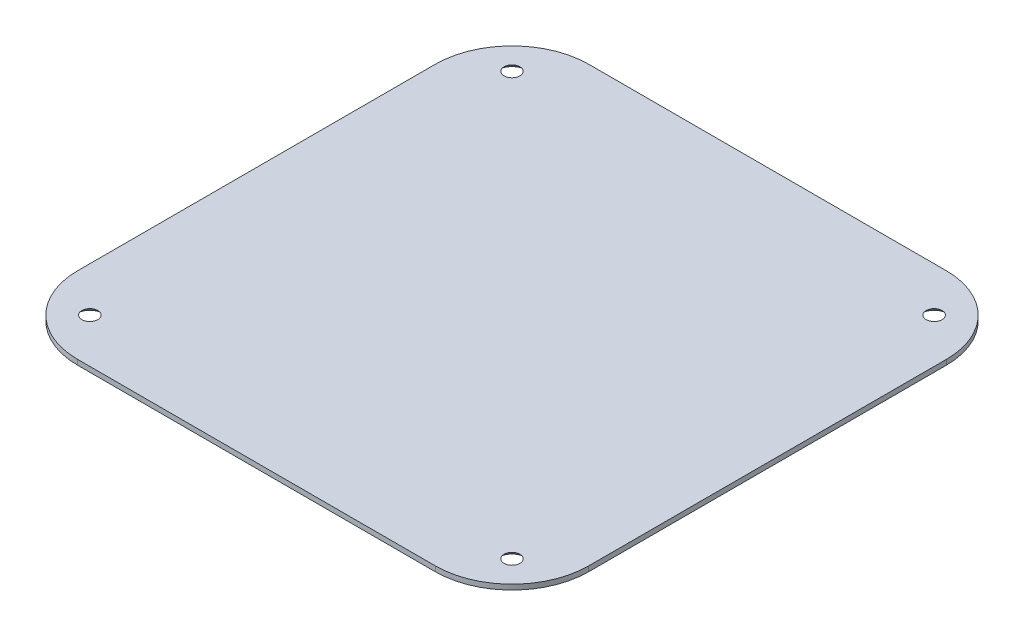
from build123d import *

# Parameters (mm, degrees)
SKETCH1_R           = 2.6
BOSS_EXTRUDE1_DEPTH = 2
CUT_EXTRUDE1_DEPTH  = 0.1
CHAMFER1_SIZE       = 2.5


with BuildPart() as part:
    # Sketch1 → Boss-Extrude1 (new body)
    with BuildSketch(Plane(origin=(0, 0, 0), x_dir=(1, 0, 0), z_dir=(0, 1, 0))):
        with BuildLine():
            Line((70, -100), (-70, -100))
            ThreePointArc((-70, -100), (-91.213203436, -91.213203436), (-100, -70))
            Line((-100, -70), (-100, 70))
            ThreePointArc((-100, 70), (-91.213203436, 91.213203436), (-70, 100))
            Line((-70, 100), (70, 100))
            ThreePointArc((70, 100), (91.213203436, 91.213203436), (100, 70))
            Line((100, 70), (100, -70))
            ThreePointArc((100, -70), (91.213203436, -91.213203436), (70, -100))
        make_face()
        with Locations(Location((-82.6, 82.6, 0), (0, 0, 270))):
            Circle(SKETCH1_R, mode=Mode.SUBTRACT)
        with Locations(Location((82.6, 82.6, 0), (0, 0, 270))):
            Circle(SKETCH1_R, mode=Mode.SUBTRACT)
        with Locations(Location((82.6, -82.6, 0), (0, 0, 270))):
            Circle(SKETCH1_R, mode=Mode.SUBTRACT)
        with Locations(Location((-82.6, -82.6, 0), (0, 0, 270))):
            Circle(SKETCH1_R, mode=Mode.SUBTRACT)
    extrude(amount=BOSS_EXTRUDE1_DEPTH)

    # Sketch1<3> → Cut-Extrude1 (cut)
    with BuildSketch(Plane(origin=(0, 0, 0), x_dir=(1, 0, 0), z_dir=(0, 1, 0))):
        with BuildLine():
            Line((-42.5, 50), (-42.5, 70))
            ThreePointArc((-42.5, 70), (-44.696699141, 75.303300859), (-50, 77.5))
            Line((-50, 77.5), (-70, 77.5))
            ThreePointArc((-70, 77.5), (-75.303300859, 75.303300859), (-77.5, 70))
            Line((-77.5, 70), (-77.5, 50))
            ThreePointArc((-77.5, 50), (-75.303300859, 44.696699141), (-70, 42.5))
            Line((-70, 42.5), (-50, 42.5))
            ThreePointArc((-50, 42.5), (-44.696699141, 44.696699141), (-42.5, 50))
        make_face()
        with BuildLine():
            Line((-70, 2.5), (-50, 2.5))
            ThreePointArc((-50, 2.5), (-44.696699141, 4.696699141), (-42.5, 10))
            Line((-42.5, 10), (-42.5, 30))
            ThreePointArc((-42.5, 30), (-44.696699141, 35.303300859), (-50, 37.5))
            Line((-50, 37.5), (-70, 37.5))
            ThreePointArc((-70, 37.5), (-75.303300859, 35.303300859), (-77.5, 30))
            Line((-77.5, 30), (-77.5, 10))
            ThreePointArc((-77.5, 10), (-75.303300859, 4.696699141), (-70, 2.5))
        make_face()
        with BuildLine():
            Line((-10, 77.5), (-30, 77.5))
            ThreePointArc((-30, 77.5), (-35.303300859, 75.303300859), (-37.5, 70))
            Line((-37.5, 70), (-37.5, 50))
            ThreePointArc((-37.5, 50), (-35.303300859, 44.696699141), (-30, 42.5))
            Line((-30, 42.5), (-10, 42.5))
            ThreePointArc((-10, 42.5), (-4.696699141, 44.696699141), (-2.5, 50))
            Line((-2.5, 50), (-2.5, 70))
            ThreePointArc((-2.5, 70), (-4.696699141, 75.303300859), (-10, 77.5))
        make_face()
        with BuildLine():
            Line((-10, 37.5), (-30, 37.5))
            ThreePointArc((-30, 37.5), (-35.303300859, 35.303300859), (-37.5, 30))
            Line((-37.5, 30), (-37.5, 10))
            ThreePointArc((-37.5, 10), (-35.303300859, 4.696699141), (-30, 2.5))
            Line((-30, 2.5), (-10, 2.5))
            ThreePointArc((-10, 2.5), (-4.696699141, 4.696699141), (-2.5, 10))
            Line((-2.5, 10), (-2.5, 30))
            ThreePointArc((-2.5, 30), (-4.696699141, 35.303300859), (-10, 37.5))
        make_face()
        with BuildLine():
            Line((42.5, 30), (42.5, 10))
            ThreePointArc((42.5, 10), (44.696699141, 4.696699141), (50, 2.5))
            Line((50, 2.5), (70, 2.5))
            ThreePointArc((70, 2.5), (75.303300859, 4.696699141), (77.5, 10))
            Line((77.5, 10), (77.5, 30))
            ThreePointArc((77.5, 30), (75.303300859, 35.303300859), (70, 37.5))
            Line((70, 37.5), (50, 37.5))
            ThreePointArc((50, 37.5), (44.696699141, 35.303300859), (42.5, 30))
        make_face()
        with BuildLine():
            ThreePointArc((50, 77.5), (44.696699141, 75.303300859), (42.5, 70))
            Line((42.5, 70), (42.5, 50))
            ThreePointArc((42.5, 50), (44.696699141, 44.696699141), (50, 42.5))
            Line((50, 42.5), (70, 42.5))
            ThreePointArc((70, 42.5), (75.303300859, 44.696699141), (77.5, 50))
            Line((77.5, 50), (77.5, 70))
            ThreePointArc((77.5, 70), (75.303300859, 75.303300859), (70, 77.5))
            Line((70, 77.5), (50, 77.5))
        make_face()
        with BuildLine():
            ThreePointArc((10, 77.5), (4.696699141, 75.303300859), (2.5, 70))
            Line((2.5, 70), (2.5, 50))
            ThreePointArc((2.5, 50), (4.696699141, 44.696699141), (10, 42.5))
            Line((10, 42.5), (30, 42.5))
            ThreePointArc((30, 42.5), (35.303300859, 44.696699141), (37.5, 50))
            Line((37.5, 50), (37.5, 70))
            ThreePointArc((37.5, 70), (35.303300859, 75.303300859), (30, 77.5))
            Line((30, 77.5), (10, 77.5))
        make_face()
        with BuildLine():
            ThreePointArc((30, 2.5), (35.303300859, 4.696699141), (37.5, 10))
            Line((37.5, 10), (37.5, 30))
            ThreePointArc((37.5, 30), (35.303300859, 35.303300859), (30, 37.5))
            Line((30, 37.5), (10, 37.5))
            ThreePointArc((10, 37.5), (4.696699141, 35.303300859), (2.5, 30))
            Line((2.5, 30), (2.5, 10))
            ThreePointArc((2.5, 10), (4.696699141, 4.696699141), (10, 2.5))
            Line((10, 2.5), (30, 2.5))
        make_face()
        with BuildLine():
            ThreePointArc((-50, -77.5), (-44.696699141, -75.303300859), (-42.5, -70))
            Line((-42.5, -70), (-42.5, -50))
            ThreePointArc((-42.5, -50), (-44.696699141, -44.696699141), (-50, -42.5))
            Line((-50, -42.5), (-70, -42.5))
            ThreePointArc((-70, -42.5), (-75.303300859, -44.696699141), (-77.5, -50))
            Line((-77.5, -50), (-77.5, -70))
            ThreePointArc((-77.5, -70), (-75.303300859, -75.303300859), (-70, -77.5))
            Line((-70, -77.5), (-50, -77.5))
        make_face()
        with BuildLine():
            ThreePointArc((-10, -77.5), (-4.696699141, -75.303300859), (-2.5, -70))
            Line((-2.5, -70), (-2.5, -50))
            ThreePointArc((-2.5, -50), (-4.696699141, -44.696699141), (-10, -42.5))
            Line((-10, -42.5), (-30, -42.5))
            ThreePointArc((-30, -42.5), (-35.303300859, -44.696699141), (-37.5, -50))
            Line((-37.5, -50), (-37.5, -70))
            ThreePointArc((-37.5, -70), (-35.303300859, -75.303300859), (-30, -77.5))
            Line((-30, -77.5), (-10, -77.5))
        make_face()
        with BuildLine():
            ThreePointArc((30, -77.5), (35.303300859, -75.303300859), (37.5, -70))
            Line((37.5, -70), (37.5, -50))
            ThreePointArc((37.5, -50), (35.303300859, -44.696699141), (30, -42.5))
            Line((30, -42.5), (10, -42.5))
            ThreePointArc((10, -42.5), (4.696699141, -44.696699141), (2.5, -50))
            Line((2.5, -50), (2.5, -70))
            ThreePointArc((2.5, -70), (4.696699141, -75.303300859), (10, -77.5))
            Line((10, -77.5), (30, -77.5))
        make_face()
        with BuildLine():
            ThreePointArc((70, -77.5), (75.303300859, -75.303300859), (77.5, -70))
            Line((77.5, -70), (77.5, -50))
            ThreePointArc((77.5, -50), (75.303300859, -44.696699141), (70, -42.5))
            Line((70, -42.5), (50, -42.5))
            ThreePointArc((50, -42.5), (44.696699141, -44.696699141), (42.5, -50))
            Line((42.5, -50), (42.5, -70))
            ThreePointArc((42.5, -70), (44.696699141, -75.303300859), (50, -77.5))
            Line((50, -77.5), (70, -77.5))
        make_face()
        with BuildLine():
            ThreePointArc((42.5, -30), (44.696699141, -35.303300859), (50, -37.5))
            Line((50, -37.5), (70, -37.5))
            ThreePointArc((70, -37.5), (75.303300859, -35.303300859), (77.5, -30))
            Line((77.5, -30), (77.5, -10))
            ThreePointArc((77.5, -10), (75.303300859, -4.696699141), (70, -2.5))
            Line((70, -2.5), (50, -2.5))
            ThreePointArc((50, -2.5), (44.696699141, -4.696699141), (42.5, -10))
            Line((42.5, -10), (42.5, -30))
        make_face()
        with BuildLine():
            Line((37.5, -30), (37.5, -10))
            ThreePointArc((37.5, -10), (35.303300859, -4.696699141), (30, -2.5))
            Line((30, -2.5), (10, -2.5))
            ThreePointArc((10, -2.5), (4.696699141, -4.696699141), (2.5, -10))
            Line((2.5, -10), (2.5, -30))
            ThreePointArc((2.5, -30), (4.696699141, -35.303300859), (10, -37.5))
            Line((10, -37.5), (30, -37.5))
            ThreePointArc((30, -37.5), (35.303300859, -35.303300859), (37.5, -30))
        make_face()
        with BuildLine():
            ThreePointArc((-37.5, -30), (-35.303300859, -35.303300859), (-30, -37.5))
            Line((-30, -37.5), (-10, -37.5))
            ThreePointArc((-10, -37.5), (-4.696699141, -35.303300859), (-2.5, -30))
            Line((-2.5, -30), (-2.5, -10))
            ThreePointArc((-2.5, -10), (-4.696699141, -4.696699141), (-10, -2.5))
            Line((-10, -2.5), (-30, -2.5))
            ThreePointArc((-30, -2.5), (-35.303300859, -4.696699141), (-37.5, -10))
            Line((-37.5, -10), (-37.5, -30))
        make_face()
        with BuildLine():
            Line((-42.5, -30), (-42.5, -10))
            ThreePointArc((-42.5, -10), (-44.696699141, -4.696699141), (-50, -2.5))
            Line((-50, -2.5), (-70, -2.5))
            ThreePointArc((-70, -2.5), (-75.303300859, -4.696699141), (-77.5, -10))
            Line((-77.5, -10), (-77.5, -30))
            ThreePointArc((-77.5, -30), (-75.303300859, -35.303300859), (-70, -37.5))
            Line((-70, -37.5), (-50, -37.5))
            ThreePointArc((-50, -37.5), (-44.696699141, -35.303300859), (-42.5, -30))
        make_face()
    extrude(amount=CUT_EXTRUDE1_DEPTH, mode=Mode.SUBTRACT)

    # Chamfer1
    # the kernel refuses this chamfer: 2.5 mm, written as the material it takes off along each edge
    with BuildSketch(Plane(origin=(82.6, 0, 82.6), x_dir=(0, 0, 1), z_dir=(-1, 0, 0))) as chamfer1_piece_1:
        Polygon((2.6 + CHAMFER1_SIZE, 0), (2.6, CHAMFER1_SIZE), (2.6, 0), align=None)
    revolve(axis=Axis((82.6, 0, 82.6), (0, 1, 0)), mode=Mode.SUBTRACT)
    with BuildSketch(Plane(origin=(-82.6, 0, 82.6), x_dir=(0, 0, 1), z_dir=(-1, 0, 0))) as chamfer1_piece_2:
        Polygon((2.6 + CHAMFER1_SIZE, 0), (2.6, CHAMFER1_SIZE), (2.6, 0), align=None)
    revolve(axis=Axis((-82.6, 0, 82.6), (0, 1, 0)), mode=Mode.SUBTRACT)
    with BuildSketch(Plane(origin=(-82.6, 0, -82.6), x_dir=(0, 0, 1), z_dir=(-1, 0, 0))) as chamfer1_piece_3:
        Polygon((2.6 + CHAMFER1_SIZE, 0), (2.6, CHAMFER1_SIZE), (2.6, 0), align=None)
    revolve(axis=Axis((-82.6, 0, -82.6), (0, 1, 0)), mode=Mode.SUBTRACT)
    with BuildSketch(Plane(origin=(82.6, 0, -82.6), x_dir=(0, 0, 1), z_dir=(-1, 0, 0))) as chamfer1_piece_4:
        Polygon((2.6 + CHAMFER1_SIZE, 0), (2.6, CHAMFER1_SIZE), (2.6, 0), align=None)
    revolve(axis=Axis((82.6, 0, -82.6), (0, 1, 0)), mode=Mode.SUBTRACT)


solid = part.part
